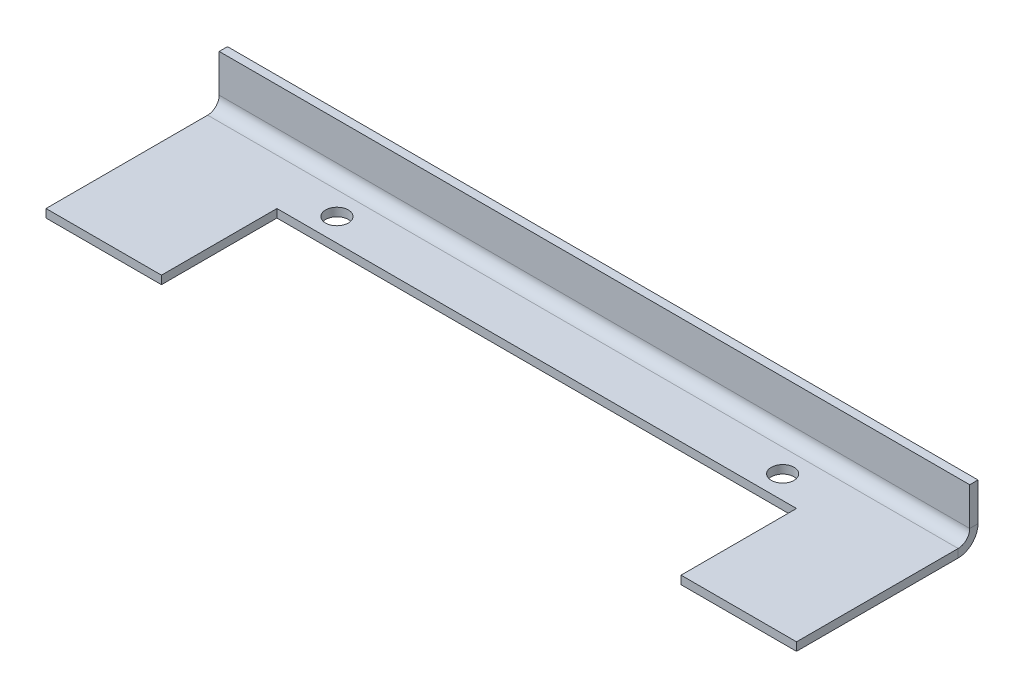
from build123d import *

# Parameters (mm, degrees)
BASE_FLANGE1_DEPTH           = 0.91186
F_2_5MM_DOWEL_HOLE1_D        = 2.5
EDGE_FLANGE1_STRIP_W         = 6.18744
EDGE_FLANGE1_STRIP_H         = 0.91186
EDGE_FLANGE1_STRIP_CUT_DEPTH = 82.55
EDGE_FLANGE1_DEPTH           = 82.55


# Sheet-metal steps are written as plain solids
with BuildPart() as part:
    # Sketch1 → Base-Flange1 (new body)
    with BuildSketch(Plane(origin=(0, 0, 0), x_dir=(1, 0, 0), z_dir=(0, 1, 0))):
        Polygon((0, 0), (0, -19.05), (12.7, -19.05), (12.7, -6.35), (69.85, -6.35), (69.85, -19.05), (82.55, -19.05), (82.55, 0), align=None)
    extrude(amount=-BASE_FLANGE1_DEPTH)

    # Ø2.5mm Dowel Hole1 (through all)
    with Locations(Plane(origin=(0, -0.91186, 0), x_dir=(-1, 0, 0), z_dir=(0, -1, 0))):
        with Locations((-65.786, -3.81), (-16.764, -3.81)):
            Hole(F_2_5MM_DOWEL_HOLE1_D / 2)

    # Edge-Flange1 strip (across the edge) → Edge-Flange1 strip cut (cut)
    with BuildSketch(Plane.ZY.offset(-82.55)):
        with Locations((-1.82372, -0.45593)):
            Rectangle(EDGE_FLANGE1_STRIP_W, EDGE_FLANGE1_STRIP_H)
    extrude(amount=EDGE_FLANGE1_STRIP_CUT_DEPTH, mode=Mode.SUBTRACT)

    # Edge-Flange1 section (across the edge) → Edge-Flange1 (add)
    with BuildSketch(Plane.ZY.offset(-82.55)):
        with BuildLine():
            Line((-0.91186, 1.27), (-0.91186, 5.43814))
            Line((-0.91186, 5.43814), (0, 5.43814))
            Line((0, 5.43814), (0, 1.27))
            ThreePointArc((0, 1.27), (0.371974388, 0.371974388), (1.27, 0))
            Line((1.27, 0), (1.27, -0.91186))
            ThreePointArc((1.27, -0.91186), (-0.272808002, -0.272808002), (-0.91186, 1.27))
        make_face()
    extrude(amount=EDGE_FLANGE1_DEPTH)


solid = part.part
